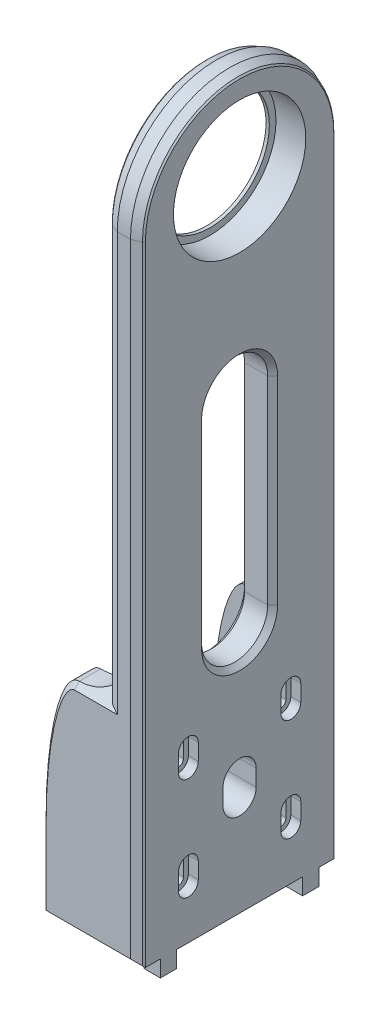
from build123d import *

# Parameters (mm, degrees)
SKETCH1_W           = 30
SKETCH1_H           = 5
BOSS_EXTRUDE1_DEPTH = 30
SKETCH2_W           = 10
SKETCH2_H           = 60
BOSS_EXTRUDE2_DEPTH = 215
SKETCH4_R           = 18
CUT_EXTRUDE1_DEPTH  = 10
CUT_EXTRUDE2_DEPTH  = 3
SKETCH6_R           = 20.01
CUT_EXTRUDE3_DEPTH  = 9
SKETCH7_R           = 1.5
SKETCH7_R_2         = 1.325
CUT_EXTRUDE4_DEPTH  = 15
SKETCH8_W           = 4.95
SKETCH8_H           = 4.9
BOSS_EXTRUDE3_DEPTH = 5
SKETCH10_W          = 8
SKETCH10_H          = 60
BOSS_EXTRUDE4_DEPTH = 20
FILLET1_RADIUS      = 30
FILLET1_LENGTH      = 10
FILLET3_SIZE        = 10
FILLET3_SIZE_2      = 40
FILLET4_SIZE        = 10
FILLET4_SIZE_2      = 40
CHAMFER1_SIZE       = 1.5
CHAMFER2_SIZE       = 1.5
CHAMFER3_SIZE       = 1.5
FILLET7_START       = 22
FILLET7_DEPTH       = 3.23595
FILLET7_START_2     = 25.23595
FILLET7_2_DEPTH     = 3.2640501
FILLET7_START_3     = -6
FILLET7_3_DEPTH     = 11
FILLET8_START       = -25.26405
FILLET8_DEPTH       = 3.26405
FILLET8_START_2     = -28.5000001
FILLET8_2_DEPTH     = 3.2359501
FILLET8_START_3     = -6
FILLET8_3_DEPTH     = 11


with BuildPart() as part:
    # Sketch1 → Boss-Extrude1 (new, symmetric)
    with BuildSketch(Plane.XY):
        with Locations((0, -2.5)):
            Rectangle(SKETCH1_W, SKETCH1_H)
    extrude(amount=BOSS_EXTRUDE1_DEPTH, both=True)

    # Sketch2 → Boss-Extrude2 (add)
    with BuildSketch(Plane(origin=(0, 0, 0), x_dir=(1, 0, 0), z_dir=(0, 1, 0))):
        with Locations((10, 0)):
            Rectangle(SKETCH2_W, SKETCH2_H)
    extrude(amount=BOSS_EXTRUDE2_DEPTH)

    # Sketch4 → Cut-Extrude1 (cut)
    with BuildSketch(Plane.ZY.offset(-5)):
        with Locations((0, 188)):
            Circle(SKETCH4_R)
        with BuildLine():
            Line((-17, 41), (-17, 46))
            ThreePointArc((-17, 46), (-15.5, 47.5), (-14, 46))
            Line((-14, 46), (-14, 41))
            ThreePointArc((-14, 41), (-15.5, 39.5), (-17, 41))
        make_face()
        with BuildLine():
            Line((14, 41), (14, 46))
            ThreePointArc((14, 46), (15.5, 47.5), (17, 46))
            Line((17, 46), (17, 41))
            ThreePointArc((17, 41), (15.5, 39.5), (14, 41))
        make_face()
        with BuildLine():
            Line((14, 10), (14, 15))
            ThreePointArc((14, 15), (15.5, 16.5), (17, 15))
            Line((17, 15), (17, 10))
            ThreePointArc((17, 10), (15.5, 8.5), (14, 10))
        make_face()
        with BuildLine():
            Line((-17, 10), (-17, 15))
            ThreePointArc((-17, 15), (-15.5, 16.5), (-14, 15))
            Line((-14, 15), (-14, 10))
            ThreePointArc((-14, 10), (-15.5, 8.5), (-17, 10))
        make_face()
        with BuildLine():
            Line((-5, 25.5), (-5, 30.5))
            ThreePointArc((-5, 30.5), (0, 35.5), (5, 30.5))
            Line((5, 30.5), (5, 25.5))
            ThreePointArc((5, 25.5), (0, 20.5), (-5, 25.5))
        make_face()
        with BuildLine():
            Line((-10, 70), (-10, 130))
            ThreePointArc((-10, 130), (0, 140), (10, 130))
            Line((10, 130), (10, 70))
            ThreePointArc((10, 70), (0, 60), (-10, 70))
        make_face()
    extrude(amount=-CUT_EXTRUDE1_DEPTH, mode=Mode.SUBTRACT)

    # Sketch5 → Cut-Extrude2 (cut)
    with BuildSketch(Plane(origin=(15, 0, 0), x_dir=(0, 0, -1), z_dir=(1, 0, 0))):
        with BuildLine():
            Line((-18.5, 41), (-18.5, 46))
            ThreePointArc((-18.5, 46), (-15.5, 49), (-12.5, 46))
            Line((-12.5, 46), (-12.5, 41))
            ThreePointArc((-12.5, 41), (-15.5, 38), (-18.5, 41))
        make_face()
        with BuildLine():
            Line((12.5, 41), (12.5, 46))
            ThreePointArc((12.5, 46), (15.5, 49), (18.5, 46))
            Line((18.5, 46), (18.5, 41))
            ThreePointArc((18.5, 41), (15.5, 38), (12.5, 41))
        make_face()
        with BuildLine():
            Line((12.5, 10), (12.5, 15))
            ThreePointArc((12.5, 15), (15.5, 18), (18.5, 15))
            Line((18.5, 15), (18.5, 10))
            ThreePointArc((18.5, 10), (15.5, 7), (12.5, 10))
        make_face()
        with BuildLine():
            Line((-18.5, 10), (-18.5, 15))
            ThreePointArc((-18.5, 15), (-15.5, 18), (-12.5, 15))
            Line((-12.5, 15), (-12.5, 10))
            ThreePointArc((-12.5, 10), (-15.5, 7), (-18.5, 10))
        make_face()
    extrude(amount=-CUT_EXTRUDE2_DEPTH, mode=Mode.SUBTRACT)

    # Sketch6 → Cut-Extrude3 (cut)
    with BuildSketch(Plane(origin=(15, 0, 0), x_dir=(0, 0, -1), z_dir=(1, 0, 0))):
        with Locations((0, 188)):
            Circle(SKETCH6_R)
    extrude(amount=-CUT_EXTRUDE3_DEPTH, mode=Mode.SUBTRACT)

    # Sketch7 → Cut-Extrude4 (cut)
    with BuildSketch(Plane.XZ.offset(5)):
        with Locations(Location((0, -15, 0), (0, 0, 270))):
            Circle(SKETCH7_R)
        with Locations(Location((0, 15, 0), (0, 0, 270))):
            Circle(SKETCH7_R)
        with Locations(Location((10, 0, 0), (0, 0, 90))):
            Circle(SKETCH7_R_2)
    extrude(amount=-CUT_EXTRUDE4_DEPTH, mode=Mode.SUBTRACT)

    # Sketch8 → Boss-Extrude3 (add)
    with BuildSketch(Plane.XZ.offset(5)):
        with Locations((12.525, 21.5)):
            Rectangle(SKETCH8_W, SKETCH8_H)
        with Locations((12.525, -21.5)):
            Rectangle(SKETCH8_W, SKETCH8_H)
    extrude(amount=BOSS_EXTRUDE3_DEPTH)

    # Sketch10 → Boss-Extrude4 (add)
    with BuildSketch(Plane.ZY.offset(-5)):
        with Locations((26, 30)):
            Rectangle(SKETCH10_W, SKETCH10_H)
        with Locations((-26, 30)):
            Rectangle(SKETCH10_W, SKETCH10_H)
    extrude(amount=BOSS_EXTRUDE4_DEPTH)

    # Fillet1: full round fillet: the end face becomes a half cylinder, R = half its width
    fillet1_face = Plane((10, 215, 0), x_dir=(-1, 0, 0), z_dir=(0, 1, 0))  # on the end face: x along it, z out of the body
    fillet1_slab = fillet1_face.offset(-FILLET1_RADIUS / 2) * Box(FILLET1_LENGTH, 2 * FILLET1_RADIUS, FILLET1_RADIUS, mode=Mode.PRIVATE)  # the body's end, R deep
    fillet1_round = Plane((10, 185, 0), x_dir=(0, 1, 0), z_dir=(-1, 0, 0)) * Cylinder(FILLET1_RADIUS, FILLET1_LENGTH, mode=Mode.PRIVATE)  # its axis R under the face
    add(fillet1_slab - fillet1_round, mode=Mode.SUBTRACT)

    # Fillet3
    # a fillet whose section is not a circle: 40, 10 mm, written as the material it takes off along each edge
    with BuildSketch(Plane(origin=(-15, 60, 78), x_dir=(1, 0, 0), z_dir=(0, 0, -1))) as fillet3_piece_1_section:
        with BuildLine():
            Bezier((FILLET3_SIZE, 0), (0, 0), (0, FILLET3_SIZE_2), weights=[1, 0.707106781, 1])
            Line((0, FILLET3_SIZE_2), (0, 0))
            Line((0, 0), (FILLET3_SIZE, 0))
        make_face()
    fillet3_piece_1 = extrude(amount=208, mode=Mode.PRIVATE)
    fillet3_piece_1 = split(fillet3_piece_1, bisect_by=Plane(origin=(-15, 60, 22), z_dir=(0, 0, -1)), keep=Keep.TOP, mode=Mode.PRIVATE)
    add(fillet3_piece_1, mode=Mode.SUBTRACT)

    # Fillet4
    # a fillet whose section is not a circle: 40, 10 mm, written as the material it takes off along each edge
    with BuildSketch(Plane(origin=(-15, 60, -78), x_dir=(1, 0, 0), z_dir=(0, 0, 1))) as fillet4_piece_1:
        with BuildLine():
            Bezier((FILLET4_SIZE, 0), (0, 0), (0, -FILLET4_SIZE_2), weights=[1, 0.707106781, 1])
            Line((0, -FILLET4_SIZE_2), (0, 0))
            Line((0, 0), (FILLET4_SIZE, 0))
        make_face()
    extrude(amount=208, mode=Mode.SUBTRACT)

    # Chamfer1
    chamfer1_edges = [part.edges().sort_by_distance(p)[0] for p in [
        (5, 122.5, -30),
        (15, 90, -30),
        (5, 215, 0),
        (15, 215, 0),
        (5, 122.5, 30),
        (15, 90, 30),
        (0, -5, 30),
        (-15, 7.5, 30),
        (-13.453414336, 41.369056546, 30),
        (0, 60, 30),
    ]]
    chamfer(chamfer1_edges, length=CHAMFER1_SIZE)

    # Chamfer2
    chamfer2_edges = [part.edges().sort_by_distance(p)[0] for p in [
        (13.5, 90.75, 30),
        (13.5, 215, 0),
        (13.5, 90, -30),
        (6.5, 121.75, 30),
        (6.5, 215, 0),
        (6.5, 122.5, -30),
        (-0.75, -5, -30),
        (-15, 7.5, -30),
        (-13.452762376, 41.373182547, -30),
        (0.75, 60, -30),
    ]]
    chamfer(chamfer2_edges, length=CHAMFER2_SIZE - 0.0001)  # a hair under: the kernel refuses the full size

    # Chamfer3
    chamfer3_edges = [part.edges().sort_by_distance(p)[0] for p in [
        (15, 60, 0),
        (15, 100, -10),
        (15, 140, 0),
        (15, 100, 10),
        (5, 60, 0),
        (5, 100, 10),
        (5, 140, 0),
        (5, 100, -10),
    ]]
    chamfer(chamfer3_edges, length=CHAMFER3_SIZE)

    # Fillet7: read off the stored shape, not the designer's step
    # Fillet7 outline → Fillet7 (add)
    with BuildSketch(Plane.XY.offset(FILLET7_START)):
        with BuildLine():
            Line((5, 60), (5, 65))
            add(Edge.make_bspline(
                [(5, 65), (5, 60), (-5, 60)],
                knots=[0, 0, 0, 1, 1, 1], degree=2, weights=[1, 0.707106781, 1]))
            Line((-5, 60), (5, 60))
        make_face()
    extrude(amount=FILLET7_DEPTH)

    # Fillet7 2 outline → Fillet7 2 (add)
    with BuildSketch(Plane.XY.offset(FILLET7_START_2)):
        with BuildLine():
            Line((5, 60), (5, 65))
            add(Edge.make_bspline(
                [(5, 65), (5, 60), (-5, 60)],
                knots=[0, 0, 0, 1, 1, 1], degree=2, weights=[1, 0.707106781, 1]))
            Line((-5, 60), (5, 60))
        make_face()
    extrude(amount=FILLET7_2_DEPTH)

    # Fillet7 3 outline → Fillet7 3 (cut)
    with BuildSketch(Plane.YZ.offset(FILLET7_START_3)):
        Polygon((60, 28.5000001), (65.5, 23), (67, 23), (67, 28.5000001), align=None)
    extrude(amount=FILLET7_3_DEPTH, mode=Mode.SUBTRACT)

    # Fillet8: read off the stored shape, not the designer's step
    # Fillet8 outline → Fillet8 (add)
    with BuildSketch(Plane.XY.offset(FILLET8_START)):
        with BuildLine():
            Line((5, 60), (5, 65))
            add(Edge.make_bspline(
                [(5, 65), (5, 60), (-5, 60)],
                knots=[0, 0, 0, 1, 1, 1], degree=2, weights=[1, 0.707106781, 1]))
            Line((-5, 60), (5, 60))
        make_face()
    extrude(amount=FILLET8_DEPTH)

    # Fillet8 2 outline → Fillet8 2 (add)
    with BuildSketch(Plane.XY.offset(FILLET8_START_2)):
        with BuildLine():
            Line((5, 60), (5, 65))
            add(Edge.make_bspline(
                [(5, 65), (5, 60), (-5, 60)],
                knots=[0, 0, 0, 1, 1, 1], degree=2, weights=[1, 0.707106781, 1]))
            Line((-5, 60), (5, 60))
        make_face()
    extrude(amount=FILLET8_2_DEPTH)

    # Fillet8 3 outline → Fillet8 3 (cut)
    with BuildSketch(Plane.YZ.offset(FILLET8_START_3)):
        Polygon((65.5, -23), (60, -28.5000001), (67, -28.5000001), (67, -23), align=None)
    extrude(amount=FILLET8_3_DEPTH, mode=Mode.SUBTRACT)


solid = part.part
